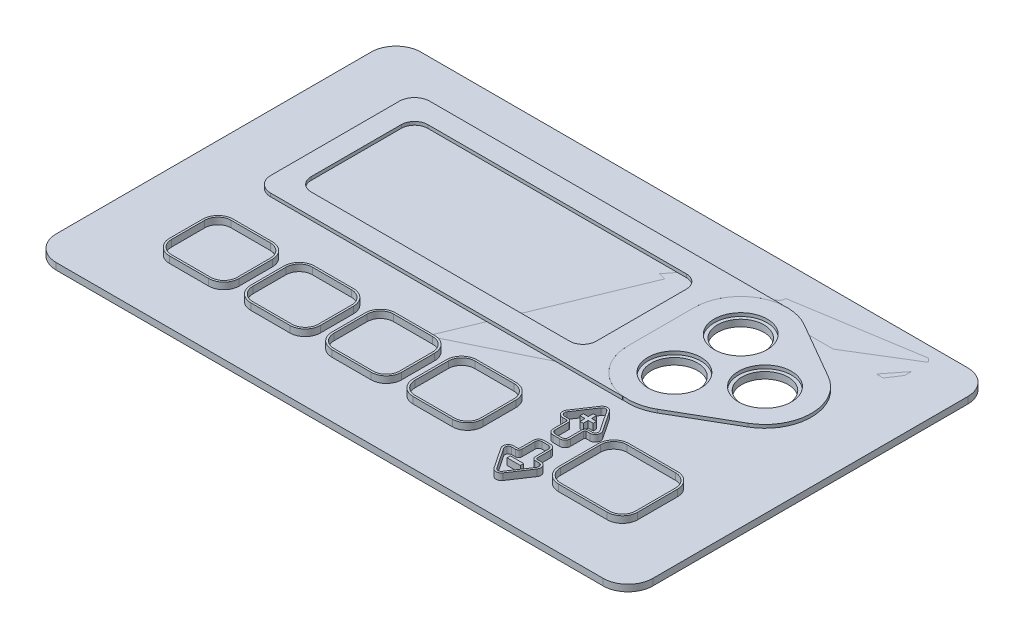
from build123d import *

# Parameters (mm, degrees)
MOUNTING_PLATE_OUTLINE_W   = 150
MOUNTING_PLATE_OUTLINE_H   = 103.2
MOUNTING_PLATE_OUTLINE_R   = 1.5
MOUNTING_PLATE_DEPTH       = 2
CROQUIS2_W                 = 82
CROQUIS2_H                 = 12
EXTRUIR2_DEPTH             = 10
CROQUIS3_W                 = 45.5
CROQUIS3_H                 = 51.1
EXTRUIR3_DEPTH             = 10
CROQUIS4_R                 = 2
EXTRUIR4_DEPTH             = 10
CROQUIS5_R                 = 4
EXTRUIR5_DEPTH             = 10
REDONDEO1_R                = 1
TROQUELADO_TAPA_CAJA_DEPTH = 2
CROQUIS10_R                = 7
EXTRUIR9_DEPTH             = 2
PEGATINA_DEPTH             = 1
CROQUIS12_OUTSIDE_W        = 224.192
CROQUIS12_OUTSIDE_H        = 154.192
EXTRUIR11_DEPTH            = 1
CROQUIS13_R                = 8
CROQUIS13_W                = 80
CROQUIS13_H                = 29.2
EXTRUIR12_DEPTH            = 1
REDONDEO4_R                = 1
CROQUIS16_R                = 8
EXTRUIR15_DEPTH            = 2
EXTRUIR16_DEPTH            = 0.1
EXTRUIR17_DEPTH            = 2
EXTRUIR20_DEPTH            = 0.1
EXTRUIR20_2_DEPTH          = 0.1
REDONDEO5_R                = 1
REDONDEO6_R                = 1
EXTRUIR21_DEPTH            = 3
EXTRUIR21_2_DEPTH          = 3
EXTRUIR21_3_DEPTH          = 3
CROQUIS22_W                = 4
CROQUIS22_H                = 1
EXTRUIR21_4_DEPTH          = 3
EXTRUIR21_5_DEPTH          = 3
EXTRUIR22_DEPTH            = 0.1
EXTRUIR23_DEPTH            = 3
EXTRUIR23_2_DEPTH          = 3
EXTRUIR23_3_DEPTH          = 3
EXTRUIR23_4_DEPTH          = 3
EXTRUIR24_DEPTH            = 0.1
EXTRUIR24_2_DEPTH          = 0.1
EXTRUIR24_3_DEPTH          = 0.1
EXTRUIR24_4_DEPTH          = 0.1


with BuildPart() as part:
    # Mounting Plate: read off the stored shape, not the designer's step
    # Mounting Plate outline → Mounting Plate (new body)
    with BuildSketch(Plane(origin=(0, 0, 0), x_dir=(1, 0, 0), z_dir=(0, 1, 0))):
        Rectangle(MOUNTING_PLATE_OUTLINE_W, MOUNTING_PLATE_OUTLINE_H)
        with Locations((-69, -9)):
            Circle(MOUNTING_PLATE_OUTLINE_R, mode=Mode.SUBTRACT)
        with Locations((24, -9)):
            Circle(MOUNTING_PLATE_OUTLINE_R, mode=Mode.SUBTRACT)
        with Locations((-69, 46)):
            Circle(MOUNTING_PLATE_OUTLINE_R, mode=Mode.SUBTRACT)
        with Locations((24, 46)):
            Circle(MOUNTING_PLATE_OUTLINE_R, mode=Mode.SUBTRACT)
    extrude(amount=MOUNTING_PLATE_DEPTH)

    # Croquis2 → Extruir2 (cut)
    with BuildSketch(Plane(origin=(0, 2, 0), x_dir=(1, 0, 0), z_dir=(0, 1, 0))):
        with Locations((-23.5, 45.6)):
            Rectangle(CROQUIS2_W, CROQUIS2_H)
    extrude(amount=-EXTRUIR2_DEPTH, mode=Mode.SUBTRACT)

    # Croquis3 → Extruir3 (cut)
    with BuildSketch(Plane(origin=(0, 2, 0), x_dir=(1, 0, 0), z_dir=(0, 1, 0))):
        with Locations((52.25, 14.05)):
            Rectangle(CROQUIS3_W, CROQUIS3_H)
    extrude(amount=-EXTRUIR3_DEPTH, mode=Mode.SUBTRACT)

    # Croquis4 → Extruir4 (cut)
    with BuildSketch(Plane(origin=(0, 2, 0), x_dir=(1, 0, 0), z_dir=(0, 1, 0))):
        with Locations(Location((-67, -19.5, 0), (0, 0, 270))):
            Circle(CROQUIS4_R)
        with Locations(Location((67, -19.5, 0), (0, 0, 270))):
            Circle(CROQUIS4_R)
        with Locations(Location((0, -43.6, 0), (0, 0, 270))):
            Circle(CROQUIS4_R)
        with Locations(Location((35, 45.6, 0), (0, 0, 270))):
            Circle(CROQUIS4_R)
    extrude(amount=-EXTRUIR4_DEPTH, mode=Mode.SUBTRACT)

    # Croquis5 → Extruir5 (cut)
    with BuildSketch(Plane(origin=(0, 2, 0), x_dir=(1, 0, 0), z_dir=(0, 1, 0))):
        with Locations(Location((-59.25, -28.56, 0), (0, 0, 270))):
            Circle(CROQUIS5_R)
        with Locations(Location((-34.75, -28.56, 0), (0, 0, 270))):
            Circle(CROQUIS5_R)
        with Locations(Location((-10.25, -28.56, 0), (0, 0, 270))):
            Circle(CROQUIS5_R)
        with Locations(Location((14.25, -28.56, 0), (0, 0, 270))):
            Circle(CROQUIS5_R)
    extrude(amount=-EXTRUIR5_DEPTH, mode=Mode.SUBTRACT)

    # Redondeo1
    redondeo1_edges = [part.edges().sort_by_distance(p)[0] for p in [
        (17.5, 1, -51.6),
        (-64.5, 1, -51.6),
        (17.5, 1, -39.6),
        (-64.5, 1, -39.6),
        (75, 1, 11.5),
        (75, 1, -39.6),
        (29.5, 1, 11.5),
        (29.5, 1, -39.6),
        (-75, 1, -51.6),
        (75, 1, -51.6),
        (75, 1, 51.6),
        (-75, 1, 51.6),
    ]]
    fillet(redondeo1_edges, radius=REDONDEO1_R)


with BuildPart() as body_2:
    # Troquelado Tapa Caja: read off the stored shape, not the designer's step
    # Troquelado Tapa Caja outline → Troquelado Tapa Caja (new body)
    with BuildSketch(Plane(origin=(0, 0, 0), x_dir=(1, 0, 0), z_dir=(0, 1, 0))):
        with BuildLine():
            ThreePointArc((-82.5, 55), (-87.803300859, 52.803300859), (-90, 47.5))
            Line((-90, 47.5), (-90, -47.5))
            ThreePointArc((-90, -47.5), (-87.803300859, -52.803300859), (-82.5, -55))
            Line((-82.5, -55), (82.5, -55))
            ThreePointArc((82.5, -55), (87.803300859, -52.803300859), (90, -47.5))
            Line((90, -47.5), (90, 47.5))
            ThreePointArc((90, 47.5), (87.803300859, 52.803300859), (82.5, 55))
            Line((82.5, 55), (-82.5, 55))
        make_face()
    extrude(amount=TROQUELADO_TAPA_CAJA_DEPTH)

    # Croquis10 → Extruir9 (cut)
    with BuildSketch(Plane(origin=(0, 2, 0), x_dir=(1, 0, 0), z_dir=(0, 1, 0))):
        with Locations(Location((40.5, 28.5, 0), (0, 0, 270))):
            Circle(CROQUIS10_R)
        with Locations(Location((40.5, 8.5, 0), (0, 0, 90))):
            Circle(CROQUIS10_R)
        with Locations(Location((57.820508076, 18.5, 0), (0, 0, 270))):
            Circle(CROQUIS10_R)
    extrude(amount=-EXTRUIR9_DEPTH, mode=Mode.SUBTRACT)


with BuildPart() as body_3:
    # Pegatina: read off the stored shape, not the designer's step
    # Pegatina outline → Pegatina (new body)
    with BuildSketch(Plane(origin=(0, 0, 0), x_dir=(1, 0, 0), z_dir=(0, 1, 0))):
        with BuildLine():
            ThreePointArc((90, 47.5), (87.803300859, 52.803300859), (82.5, 55))
            Line((82.5, 55), (-82.5, 55))
            ThreePointArc((-82.5, 55), (-87.803300859, 52.803300859), (-90, 47.5))
            Line((-90, 47.5), (-90, -47.5))
            ThreePointArc((-90, -47.5), (-87.803300859, -52.803300859), (-82.5, -55))
            Line((-82.5, -55), (82.5, -55))
            ThreePointArc((82.5, -55), (87.803300859, -52.803300859), (90, -47.5))
            Line((90, -47.5), (90, 47.5))
        make_face()
    extrude(amount=PEGATINA_DEPTH)

    # Croquis12 outside → Extruir11 (cut)
    with BuildSketch(Plane(origin=(0, 1, 0), x_dir=(1, 0, 0), z_dir=(0, 1, 0))):
        Rectangle(CROQUIS12_OUTSIDE_W, CROQUIS12_OUTSIDE_H)
        with BuildLine():
            Line((-77, 47.5), (-77, 52))
            Line((-77, 52), (77, 52))
            Line((77, 52), (77, 47.5))
            ThreePointArc((77, 47.5), (78.610912703, 43.610912703), (82.5, 42))
            Line((82.5, 42), (87, 42))
            Line((87, 42), (87, -42))
            Line((87, -42), (82.5, -42))
            ThreePointArc((82.5, -42), (78.610912703, -43.610912703), (77, -47.5))
            Line((77, -47.5), (77, -52))
            Line((77, -52), (-77, -52))
            Line((-77, -52), (-77, -47.5))
            ThreePointArc((-77, -47.5), (-78.610912703, -43.610912703), (-82.5, -42))
            Line((-82.5, -42), (-87, -42))
            Line((-87, -42), (-87, 42))
            Line((-87, 42), (-82.5, 42))
            ThreePointArc((-82.5, 42), (-78.610912703, 43.610912703), (-77, 47.5))
        make_face(mode=Mode.SUBTRACT)
    extrude(amount=-EXTRUIR11_DEPTH, mode=Mode.SUBTRACT)

    # Croquis13 → Extruir12 (cut)
    with BuildSketch(Plane(origin=(0, 1, 0), x_dir=(1, 0, 0), z_dir=(0, 1, 0))):
        with Locations(Location((57.820508076, 18.5, 0), (0, 0, 270))):
            Circle(CROQUIS13_R)
        with Locations(Location((40.5, 8.5, 0), (0, 0, 270))):
            Circle(CROQUIS13_R)
        with Locations(Location((40.5, 28.5, 0), (0, 0, 270))):
            Circle(CROQUIS13_R)
        with Locations((-22.5, 18.5)):
            Rectangle(CROQUIS13_W, CROQUIS13_H)
    extrude(amount=-EXTRUIR12_DEPTH, mode=Mode.SUBTRACT)

    # Redondeo4
    redondeo4_edges = [body_3.edges().sort_by_distance(p)[0] for p in [
        (-77, 0.5, -52),
        (77, 0.5, -52),
        (87, 0.5, -42),
        (87, 0.5, 42),
        (77, 0.5, 52),
        (-77, 0.5, 52),
        (-87, 0.5, 42),
        (-87, 0.5, -42),
        (-62.5, 0.5, -3.9),
        (-62.5, 0.5, -33.1),
        (17.5, 0.5, -33.1),
        (17.5, 0.5, -3.9),
    ]]
    fillet(redondeo4_edges, radius=REDONDEO4_R)


with BuildPart() as body_4:
    # Croquis16 → Extruir15 (new body)
    with BuildSketch(Plane(origin=(0, 1, 0), x_dir=(1, 0, 0), z_dir=(0, 1, 0))):
        with BuildLine():
            Line((26.5, 28.5), (26.5, 8.5))
            ThreePointArc((26.5, 8.5), (33.5, -3.624355653), (47.5, -3.624355653))
            Line((47.5, -3.624355653), (64.820508076, 6.375644347))
            ThreePointArc((64.820508076, 6.375644347), (71.820508076, 18.5), (64.820508076, 30.624355653))
            Line((64.820508076, 30.624355653), (47.5, 40.624355653))
            ThreePointArc((47.5, 40.624355653), (33.5, 40.624355653), (26.5, 28.5))
        make_face()
        with Locations(Location((40.5, 28.5, 0), (0, 0, 270))):
            Circle(CROQUIS16_R, mode=Mode.SUBTRACT)
        with Locations(Location((40.5, 8.5, 0), (0, 0, 270))):
            Circle(CROQUIS16_R, mode=Mode.SUBTRACT)
        with Locations(Location((57.820508076, 18.5, 0), (0, 0, 270))):
            Circle(CROQUIS16_R, mode=Mode.SUBTRACT)
    extrude(amount=EXTRUIR15_DEPTH)


with BuildPart() as body_5:
    # Croquis17 → Extruir16 (new body)
    with BuildSketch(Plane(origin=(0, 1, 0), x_dir=(1, 0, 0), z_dir=(0, 1, 0))):
        with BuildLine():
            Line((16.5, 36.1), (-61.5, 36.1))
            ThreePointArc((-61.5, 36.1), (-64.328427125, 34.928427125), (-65.5, 32.1))
            Line((-65.5, 32.1), (-65.5, 4.9))
            ThreePointArc((-65.5, 4.9), (-64.328427125, 2.071572875), (-61.5, 0.9))
            Line((-61.5, 0.9), (16.5, 0.9))
            ThreePointArc((16.5, 0.9), (19.328427125, 2.071572875), (20.5, 4.9))
            Line((20.5, 4.9), (20.5, 32.1))
            ThreePointArc((20.5, 32.1), (19.328427125, 34.928427125), (16.5, 36.1))
        make_face()
        with BuildLine():
            Line((17.5, 4.9), (17.5, 32.1))
            ThreePointArc((17.5, 32.1), (17.207106781, 32.807106781), (16.5, 33.1))
            Line((16.5, 33.1), (-61.5, 33.1))
            ThreePointArc((-61.5, 33.1), (-62.207106781, 32.807106781), (-62.5, 32.1))
            Line((-62.5, 32.1), (-62.5, 4.9))
            ThreePointArc((-62.5, 4.9), (-62.207106781, 4.192893219), (-61.5, 3.9))
            Line((-61.5, 3.9), (16.5, 3.9))
            ThreePointArc((16.5, 3.9), (17.207106781, 4.192893219), (17.5, 4.9))
        make_face(mode=Mode.SUBTRACT)
    extrude(amount=EXTRUIR16_DEPTH)


with BuildPart() as body_6:
    # Croquis18 → Extruir17 (new body)
    with BuildSketch(Plane(origin=(0, 1, 0), x_dir=(1, 0, 0), z_dir=(0, 1, 0))):
        with BuildLine():
            Line((-67.3, 42.5), (38.826679947, 42.5))
            ThreePointArc((38.826679947, 42.5), (38.8765909, 42.45298275), (38.832634823, 42.400355872))
            ThreePointArc((38.832634823, 42.400355872), (30.027581166, 37.791310121), (26.5, 28.5))
            Line((26.5, 28.5), (26.5, 8.5))
            ThreePointArc((26.5, 8.5), (30.027581166, -0.791310121), (38.832634823, -5.400355872))
            ThreePointArc((38.832634823, -5.400355872), (38.8765909, -5.45298275), (38.826679947, -5.5))
            Line((38.826679947, -5.5), (-67.3, -5.5))
            ThreePointArc((-67.3, -5.5), (-70.552691193, -4.152691193), (-71.9, -0.9))
            Line((-71.9, -0.9), (-71.9, 37.9))
            ThreePointArc((-71.9, 37.9), (-70.552691193, 41.152691193), (-67.3, 42.5))
        make_face()
        with BuildLine():
            Line((-65.5, 32.1), (-65.5, 4.9))
            ThreePointArc((-65.5, 4.9), (-64.328427125, 2.071572875), (-61.5, 0.9))
            Line((-61.5, 0.9), (16.5, 0.9))
            ThreePointArc((16.5, 0.9), (19.328427125, 2.071572875), (20.5, 4.9))
            Line((20.5, 4.9), (20.5, 32.1))
            ThreePointArc((20.5, 32.1), (19.328427125, 34.928427125), (16.5, 36.1))
            Line((16.5, 36.1), (-61.5, 36.1))
            ThreePointArc((-61.5, 36.1), (-64.328427125, 34.928427125), (-65.5, 32.1))
        make_face(mode=Mode.SUBTRACT)
    extrude(amount=EXTRUIR17_DEPTH)


with BuildPart() as body_7:
    # Croquis20 → Extruir20 (new body)
    with BuildSketch(Plane(origin=(0, 1, 0), x_dir=(1, 0, 0), z_dir=(0, 1, 0))):
        Polygon((40.5, -11.5), (46.5, -20.5), (42.5, -20.5), (42.5, -26.5), (38.5, -26.5), (38.5, -20.5), (34.5, -20.5), align=None)
        Polygon((41, -17), (41, -15.5), (40, -15.5), (40, -17), (38.5, -17), (38.5, -18), (40, -18), (40, -19.5), (41, -19.5), (41, -18), (42.5, -18), (42.5, -17), align=None, mode=Mode.SUBTRACT)
    extrude(amount=EXTRUIR20_DEPTH)

    # Redondeo5
    redondeo5_edges = [body_7.edges().sort_by_distance(p)[0] for p in [
        (46.5, 1.05, 20.5),
        (42.5, 1.05, 20.5),
        (42.5, 1.05, 26.5),
        (38.5, 1.05, 26.5),
        (38.5, 1.05, 20.5),
        (34.5, 1.05, 20.5),
        (40.5, 1.05, 11.5),
    ]]
    fillet(redondeo5_edges, radius=REDONDEO5_R)


with BuildPart() as body_8:
    # Croquis20 → Extruir20 2 (new body)
    with BuildSketch(Plane(origin=(0, 1, 0), x_dir=(1, 0, 0), z_dir=(0, 1, 0))):
        Polygon((40.5, -45.5), (46.5, -36.5), (42.5, -36.5), (42.5, -30.5), (38.5, -30.5), (38.5, -36.5), (34.5, -36.5), align=None)
        Polygon((40, -40), (41, -40), (42.5, -40), (42.5, -39), (41, -39), (40, -39), (38.5, -39), (38.5, -40), align=None, mode=Mode.SUBTRACT)
    extrude(amount=EXTRUIR20_2_DEPTH)

    # Redondeo6
    redondeo6_edges = [body_8.edges().sort_by_distance(p)[0] for p in [
        (40.5, 1.05, 45.5),
        (34.5, 1.05, 36.5),
        (38.5, 1.05, 36.5),
        (38.5, 1.05, 30.5),
        (42.5, 1.05, 30.5),
        (42.5, 1.05, 36.5),
        (46.5, 1.05, 36.5),
    ]]
    fillet(redondeo6_edges, radius=REDONDEO6_R)


with BuildPart() as body_9:
    # Croquis22 → Extruir21 (new body)
    with BuildSketch(Plane(origin=(0, 1, 0), x_dir=(1, 0, 0), z_dir=(0, 1, 0))):
        with BuildLine():
            Line((45.962763379, -18.612479686), (41.831280471, -12.415255324))
            ThreePointArc((41.831280471, -12.415255324), (40.5, -11.702775638), (39.168719529, -12.415255324))
            Line((39.168719529, -12.415255324), (35.037236621, -18.612479686))
            ThreePointArc((35.037236621, -18.612479686), (34.957837734, -20.254972681), (36.368517092, -21.1))
            Line((36.368517092, -21.1), (37.5, -21.1))
            ThreePointArc((37.5, -21.1), (37.782842712, -21.217157288), (37.9, -21.5))
            Line((37.9, -21.5), (37.9, -25.5))
            ThreePointArc((37.9, -25.5), (38.36862915, -26.63137085), (39.5, -27.1))
            Line((39.5, -27.1), (41.5, -27.1))
            ThreePointArc((41.5, -27.1), (42.63137085, -26.63137085), (43.1, -25.5))
            Line((43.1, -25.5), (43.1, -21.5))
            ThreePointArc((43.1, -21.5), (43.217157288, -21.217157288), (43.5, -21.1))
            Line((43.5, -21.1), (44.631482908, -21.1))
            ThreePointArc((44.631482908, -21.1), (46.042162266, -20.254972681), (45.962763379, -18.612479686))
        make_face()
        with BuildLine():
            Line((43.5, -20.5), (44.631482908, -20.5))
            ThreePointArc((44.631482908, -20.5), (45.513157507, -19.971857926), (45.463533203, -18.945299804))
            Line((45.463533203, -18.945299804), (41.332050294, -12.748075442))
            ThreePointArc((41.332050294, -12.748075442), (40.5, -12.302775638), (39.667949706, -12.748075442))
            Line((39.667949706, -12.748075442), (35.536466797, -18.945299804))
            ThreePointArc((35.536466797, -18.945299804), (35.486842493, -19.971857926), (36.368517092, -20.5))
            Line((36.368517092, -20.5), (37.5, -20.5))
            ThreePointArc((37.5, -20.5), (38.207106781, -20.792893219), (38.5, -21.5))
            Line((38.5, -21.5), (38.5, -25.5))
            ThreePointArc((38.5, -25.5), (38.792893219, -26.207106781), (39.5, -26.5))
            Line((39.5, -26.5), (41.5, -26.5))
            ThreePointArc((41.5, -26.5), (42.207106781, -26.207106781), (42.5, -25.5))
            Line((42.5, -25.5), (42.5, -21.5))
            ThreePointArc((42.5, -21.5), (42.792893219, -20.792893219), (43.5, -20.5))
        make_face(mode=Mode.SUBTRACT)
    extrude(amount=EXTRUIR21_DEPTH)


with BuildPart() as body_10:
    # Croquis22 → Extruir21 2 (new body)
    with BuildSketch(Plane(origin=(0, 1, 0), x_dir=(1, 0, 0), z_dir=(0, 1, 0))):
        with BuildLine():
            ThreePointArc((43.1, -35.5), (43.217157288, -35.782842712), (43.5, -35.9))
            Line((43.5, -35.9), (44.631482908, -35.9))
            ThreePointArc((44.631482908, -35.9), (46.042162266, -36.745027319), (45.962763379, -38.387520314))
            Line((45.962763379, -38.387520314), (41.831280471, -44.584744676))
            ThreePointArc((41.831280471, -44.584744676), (40.5, -45.297224362), (39.168719529, -44.584744676))
            Line((39.168719529, -44.584744676), (35.037236621, -38.387520314))
            ThreePointArc((35.037236621, -38.387520314), (34.957837734, -36.745027319), (36.368517092, -35.9))
            Line((36.368517092, -35.9), (37.5, -35.9))
            ThreePointArc((37.5, -35.9), (37.782842712, -35.782842712), (37.9, -35.5))
            Line((37.9, -35.5), (37.9, -31.5))
            ThreePointArc((37.9, -31.5), (38.36862915, -30.36862915), (39.5, -29.9))
            Line((39.5, -29.9), (41.5, -29.9))
            ThreePointArc((41.5, -29.9), (42.63137085, -30.36862915), (43.1, -31.5))
            Line((43.1, -31.5), (43.1, -35.5))
        make_face()
        with BuildLine():
            ThreePointArc((42.5, -31.5), (42.207106781, -30.792893219), (41.5, -30.5))
            Line((41.5, -30.5), (39.5, -30.5))
            ThreePointArc((39.5, -30.5), (38.792893219, -30.792893219), (38.5, -31.5))
            Line((38.5, -31.5), (38.5, -35.5))
            ThreePointArc((38.5, -35.5), (38.207106781, -36.207106781), (37.5, -36.5))
            Line((37.5, -36.5), (36.368517092, -36.5))
            ThreePointArc((36.368517092, -36.5), (35.486842493, -37.028142074), (35.536466797, -38.054700196))
            Line((35.536466797, -38.054700196), (39.667949706, -44.251924558))
            ThreePointArc((39.667949706, -44.251924558), (40.5, -44.697224362), (41.332050294, -44.251924558))
            Line((41.332050294, -44.251924558), (45.463533203, -38.054700196))
            ThreePointArc((45.463533203, -38.054700196), (45.513157507, -37.028142074), (44.631482908, -36.5))
            Line((44.631482908, -36.5), (43.5, -36.5))
            ThreePointArc((43.5, -36.5), (42.792893219, -36.207106781), (42.5, -35.5))
            Line((42.5, -35.5), (42.5, -31.5))
        make_face(mode=Mode.SUBTRACT)
    extrude(amount=EXTRUIR21_2_DEPTH)


with BuildPart() as body_11:
    # Croquis22 → Extruir21 3 (new body)
    with BuildSketch(Plane(origin=(0, 1, 0), x_dir=(1, 0, 0), z_dir=(0, 1, 0))):
        Polygon((40, -19.5), (40, -18), (38.5, -18), (38.5, -17), (40, -17), (40, -15.5), (41, -15.5), (41, -17), (42.5, -17), (42.5, -18), (41, -18), (41, -19.5), align=None)
    extrude(amount=EXTRUIR21_3_DEPTH)


with BuildPart() as body_12:
    # Croquis22 → Extruir21 4 (new body)
    with BuildSketch(Plane(origin=(0, 1, 0), x_dir=(1, 0, 0), z_dir=(0, 1, 0))):
        with Locations((40.5, -39.5)):
            Rectangle(CROQUIS22_W, CROQUIS22_H)
    extrude(amount=EXTRUIR21_4_DEPTH)


with BuildPart() as body_13:
    # Croquis22 → Extruir21 5 (new body)
    with BuildSketch(Plane(origin=(0, 1, 0), x_dir=(1, 0, 0), z_dir=(0, 1, 0))):
        with BuildLine():
            Line((72.420508076, -34.5), (72.420508076, -22.5))
            ThreePointArc((72.420508076, -22.5), (71.073199269, -19.247308807), (67.820508076, -17.9))
            Line((67.820508076, -17.9), (53.179493616, -17.9))
            ThreePointArc((53.179493616, -17.9), (49.926802422, -19.247308807), (48.579493616, -22.5))
            Line((48.579493616, -22.5), (48.579493616, -34.5))
            ThreePointArc((48.579493616, -34.5), (49.926802422, -37.752691193), (53.179493616, -39.1))
            Line((53.179493616, -39.1), (67.820508076, -39.1))
            ThreePointArc((67.820508076, -39.1), (71.073199269, -37.752691193), (72.420508076, -34.5))
        make_face()
        with BuildLine():
            ThreePointArc((49.179493616, -34.5), (50.351066491, -37.328427125), (53.179493616, -38.5))
            Line((53.179493616, -38.5), (67.820508076, -38.5))
            ThreePointArc((67.820508076, -38.5), (70.6489352, -37.328427125), (71.820508076, -34.5))
            Line((71.820508076, -34.5), (71.820508076, -22.5))
            ThreePointArc((71.820508076, -22.5), (70.6489352, -19.671572875), (67.820508076, -18.5))
            Line((67.820508076, -18.5), (53.179493616, -18.5))
            ThreePointArc((53.179493616, -18.5), (50.351066491, -19.671572875), (49.179493616, -22.5))
            Line((49.179493616, -22.5), (49.179493616, -34.5))
        make_face(mode=Mode.SUBTRACT)
    extrude(amount=EXTRUIR21_5_DEPTH)


with BuildPart() as body_14:
    # Croquis23 → Extruir22 (new body)
    with BuildSketch(Plane(origin=(0, 1, 0), x_dir=(1, 0, 0), z_dir=(0, 1, 0))):
        with BuildLine():
            Line((67.820508076, -18.5), (53.179493616, -18.5))
            ThreePointArc((53.179493616, -18.5), (50.351066491, -19.671572875), (49.179493616, -22.5))
            Line((49.179493616, -22.5), (49.179493616, -34.5))
            ThreePointArc((49.179493616, -34.5), (50.351066491, -37.328427125), (53.179493616, -38.5))
            Line((53.179493616, -38.5), (67.820508076, -38.5))
            ThreePointArc((67.820508076, -38.5), (70.6489352, -37.328427125), (71.820508076, -34.5))
            Line((71.820508076, -34.5), (71.820508076, -22.5))
            ThreePointArc((71.820508076, -22.5), (70.6489352, -19.671572875), (67.820508076, -18.5))
        make_face()
    extrude(amount=EXTRUIR22_DEPTH)


with BuildPart() as body_15:
    # Croquis25 → Extruir23 (new body)
    with BuildSketch(Plane(origin=(0, 1, 0), x_dir=(1, 0, 0), z_dir=(0, 1, 0))):
        with BuildLine():
            Line((-53.35, -18.96), (-65.15, -18.96))
            ThreePointArc((-65.15, -18.96), (-68.402691193, -20.307308807), (-69.75, -23.56))
            Line((-69.75, -23.56), (-69.75, -33.56))
            ThreePointArc((-69.75, -33.56), (-68.402691193, -36.812691193), (-65.15, -38.16))
            Line((-65.15, -38.16), (-53.35, -38.16))
            ThreePointArc((-53.35, -38.16), (-50.097308807, -36.812691193), (-48.75, -33.56))
            Line((-48.75, -33.56), (-48.75, -23.56))
            ThreePointArc((-48.75, -23.56), (-50.097308807, -20.307308807), (-53.35, -18.96))
        make_face()
        with BuildLine():
            Line((-53.35, -37.56), (-65.15, -37.56))
            ThreePointArc((-65.15, -37.56), (-67.978427125, -36.388427125), (-69.15, -33.56))
            Line((-69.15, -33.56), (-69.15, -23.56))
            ThreePointArc((-69.15, -23.56), (-67.978427125, -20.731572875), (-65.15, -19.56))
            Line((-65.15, -19.56), (-53.35, -19.56))
            ThreePointArc((-53.35, -19.56), (-50.521572875, -20.731572875), (-49.35, -23.56))
            Line((-49.35, -23.56), (-49.35, -33.56))
            ThreePointArc((-49.35, -33.56), (-50.521572875, -36.388427125), (-53.35, -37.56))
        make_face(mode=Mode.SUBTRACT)
    extrude(amount=EXTRUIR23_DEPTH)


with BuildPart() as body_16:
    # Croquis25 → Extruir23 2 (new body)
    with BuildSketch(Plane(origin=(0, 1, 0), x_dir=(1, 0, 0), z_dir=(0, 1, 0))):
        with BuildLine():
            Line((-28.85, -18.96), (-40.65, -18.96))
            ThreePointArc((-40.65, -18.96), (-43.902691193, -20.307308807), (-45.25, -23.56))
            Line((-45.25, -23.56), (-45.25, -33.56))
            ThreePointArc((-45.25, -33.56), (-43.902691193, -36.812691193), (-40.65, -38.16))
            Line((-40.65, -38.16), (-28.85, -38.16))
            ThreePointArc((-28.85, -38.16), (-25.597308807, -36.812691193), (-24.25, -33.56))
            Line((-24.25, -33.56), (-24.25, -23.56))
            ThreePointArc((-24.25, -23.56), (-25.597308807, -20.307308807), (-28.85, -18.96))
        make_face()
        with BuildLine():
            Line((-28.85, -19.56), (-40.65, -19.56))
            ThreePointArc((-40.65, -19.56), (-43.478427125, -20.731572875), (-44.65, -23.56))
            Line((-44.65, -23.56), (-44.65, -33.56))
            ThreePointArc((-44.65, -33.56), (-43.478427125, -36.388427125), (-40.65, -37.56))
            Line((-40.65, -37.56), (-28.85, -37.56))
            ThreePointArc((-28.85, -37.56), (-26.021572875, -36.388427125), (-24.85, -33.56))
            Line((-24.85, -33.56), (-24.85, -23.56))
            ThreePointArc((-24.85, -23.56), (-26.021572875, -20.731572875), (-28.85, -19.56))
        make_face(mode=Mode.SUBTRACT)
    extrude(amount=EXTRUIR23_2_DEPTH)


with BuildPart() as body_17:
    # Croquis25 → Extruir23 3 (new body)
    with BuildSketch(Plane(origin=(0, 1, 0), x_dir=(1, 0, 0), z_dir=(0, 1, 0))):
        with BuildLine():
            Line((-4.35, -18.96), (-16.15, -18.96))
            ThreePointArc((-16.15, -18.96), (-19.402691193, -20.307308807), (-20.75, -23.56))
            Line((-20.75, -23.56), (-20.75, -33.56))
            ThreePointArc((-20.75, -33.56), (-19.402691193, -36.812691193), (-16.15, -38.16))
            Line((-16.15, -38.16), (-4.35, -38.16))
            ThreePointArc((-4.35, -38.16), (-1.097308807, -36.812691193), (0.25, -33.56))
            Line((0.25, -33.56), (0.25, -23.56))
            ThreePointArc((0.25, -23.56), (-1.097308807, -20.307308807), (-4.35, -18.96))
        make_face()
        with BuildLine():
            Line((-4.35, -19.56), (-16.15, -19.56))
            ThreePointArc((-16.15, -19.56), (-18.978427125, -20.731572875), (-20.15, -23.56))
            Line((-20.15, -23.56), (-20.15, -33.56))
            ThreePointArc((-20.15, -33.56), (-18.978427125, -36.388427125), (-16.15, -37.56))
            Line((-16.15, -37.56), (-4.35, -37.56))
            ThreePointArc((-4.35, -37.56), (-1.521572875, -36.388427125), (-0.35, -33.56))
            Line((-0.35, -33.56), (-0.35, -23.56))
            ThreePointArc((-0.35, -23.56), (-1.521572875, -20.731572875), (-4.35, -19.56))
        make_face(mode=Mode.SUBTRACT)
    extrude(amount=EXTRUIR23_3_DEPTH)


with BuildPart() as body_18:
    # Croquis25 → Extruir23 4 (new body)
    with BuildSketch(Plane(origin=(0, 1, 0), x_dir=(1, 0, 0), z_dir=(0, 1, 0))):
        with BuildLine():
            Line((20.15, -18.96), (8.35, -18.96))
            ThreePointArc((8.35, -18.96), (5.097308807, -20.307308807), (3.75, -23.56))
            Line((3.75, -23.56), (3.75, -33.56))
            ThreePointArc((3.75, -33.56), (5.097308807, -36.812691193), (8.35, -38.16))
            Line((8.35, -38.16), (20.15, -38.16))
            ThreePointArc((20.15, -38.16), (23.402691193, -36.812691193), (24.75, -33.56))
            Line((24.75, -33.56), (24.75, -23.56))
            ThreePointArc((24.75, -23.56), (23.402691193, -20.307308807), (20.15, -18.96))
        make_face()
        with BuildLine():
            Line((20.15, -19.56), (8.35, -19.56))
            ThreePointArc((8.35, -19.56), (5.521572875, -20.731572875), (4.35, -23.56))
            Line((4.35, -23.56), (4.35, -33.56))
            ThreePointArc((4.35, -33.56), (5.521572875, -36.388427125), (8.35, -37.56))
            Line((8.35, -37.56), (20.15, -37.56))
            ThreePointArc((20.15, -37.56), (22.978427125, -36.388427125), (24.15, -33.56))
            Line((24.15, -33.56), (24.15, -23.56))
            ThreePointArc((24.15, -23.56), (22.978427125, -20.731572875), (20.15, -19.56))
        make_face(mode=Mode.SUBTRACT)
    extrude(amount=EXTRUIR23_4_DEPTH)


with BuildPart() as body_19:
    # Croquis26 → Extruir24 (new body)
    with BuildSketch(Plane(origin=(0, 1, 0), x_dir=(1, 0, 0), z_dir=(0, 1, 0))):
        with BuildLine():
            Line((-65.15, -37.56), (-53.35, -37.56))
            ThreePointArc((-53.35, -37.56), (-50.521572875, -36.388427125), (-49.35, -33.56))
            Line((-49.35, -33.56), (-49.35, -23.56))
            ThreePointArc((-49.35, -23.56), (-50.521572875, -20.731572875), (-53.35, -19.56))
            Line((-53.35, -19.56), (-65.15, -19.56))
            ThreePointArc((-65.15, -19.56), (-67.978427125, -20.731572875), (-69.15, -23.56))
            Line((-69.15, -23.56), (-69.15, -33.56))
            ThreePointArc((-69.15, -33.56), (-67.978427125, -36.388427125), (-65.15, -37.56))
        make_face()
    extrude(amount=EXTRUIR24_DEPTH)


with BuildPart() as body_20:
    # Croquis26 → Extruir24 2 (new body)
    with BuildSketch(Plane(origin=(0, 1, 0), x_dir=(1, 0, 0), z_dir=(0, 1, 0))):
        with BuildLine():
            Line((-28.85, -19.56), (-40.65, -19.56))
            ThreePointArc((-40.65, -19.56), (-43.478427125, -20.731572875), (-44.65, -23.56))
            Line((-44.65, -23.56), (-44.65, -33.56))
            ThreePointArc((-44.65, -33.56), (-43.478427125, -36.388427125), (-40.65, -37.56))
            Line((-40.65, -37.56), (-28.85, -37.56))
            ThreePointArc((-28.85, -37.56), (-26.021572875, -36.388427125), (-24.85, -33.56))
            Line((-24.85, -33.56), (-24.85, -23.56))
            ThreePointArc((-24.85, -23.56), (-26.021572875, -20.731572875), (-28.85, -19.56))
        make_face()
    extrude(amount=EXTRUIR24_2_DEPTH)


with BuildPart() as body_21:
    # Croquis26 → Extruir24 3 (new body)
    with BuildSketch(Plane(origin=(0, 1, 0), x_dir=(1, 0, 0), z_dir=(0, 1, 0))):
        with BuildLine():
            Line((-16.15, -37.56), (-4.35, -37.56))
            ThreePointArc((-4.35, -37.56), (-1.521572875, -36.388427125), (-0.35, -33.56))
            Line((-0.35, -33.56), (-0.35, -23.56))
            ThreePointArc((-0.35, -23.56), (-1.521572875, -20.731572875), (-4.35, -19.56))
            Line((-4.35, -19.56), (-16.15, -19.56))
            ThreePointArc((-16.15, -19.56), (-18.978427125, -20.731572875), (-20.15, -23.56))
            Line((-20.15, -23.56), (-20.15, -33.56))
            ThreePointArc((-20.15, -33.56), (-18.978427125, -36.388427125), (-16.15, -37.56))
        make_face()
    extrude(amount=EXTRUIR24_3_DEPTH)


with BuildPart() as body_22:
    # Croquis26 → Extruir24 4 (new body)
    with BuildSketch(Plane(origin=(0, 1, 0), x_dir=(1, 0, 0), z_dir=(0, 1, 0))):
        with BuildLine():
            Line((20.15, -19.56), (8.35, -19.56))
            ThreePointArc((8.35, -19.56), (5.521572875, -20.731572875), (4.35, -23.56))
            Line((4.35, -23.56), (4.35, -33.56))
            ThreePointArc((4.35, -33.56), (5.521572875, -36.388427125), (8.35, -37.56))
            Line((8.35, -37.56), (20.15, -37.56))
            ThreePointArc((20.15, -37.56), (22.978427125, -36.388427125), (24.15, -33.56))
            Line((24.15, -33.56), (24.15, -23.56))
            ThreePointArc((24.15, -23.56), (22.978427125, -20.731572875), (20.15, -19.56))
        make_face()
    extrude(amount=EXTRUIR24_4_DEPTH)


solid = Compound([part.part, body_2.part, body_3.part, body_4.part, body_5.part, body_6.part, body_7.part, body_8.part, body_9.part, body_10.part, body_11.part, body_12.part, body_13.part, body_14.part, body_15.part, body_16.part, body_17.part, body_18.part, body_19.part, body_20.part, body_21.part, body_22.part])
